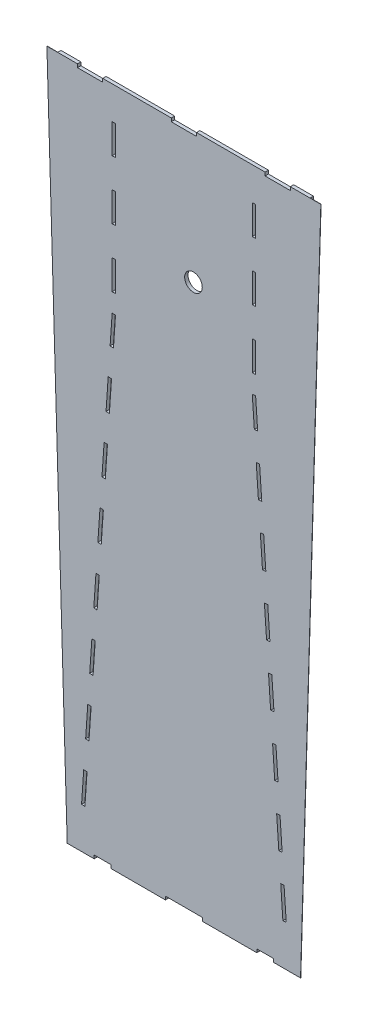
from build123d import *

# Parameters (mm, degrees)
SKETCH1_W           = 10.166490401
SKETCH1_H           = 88.9
BOSS_EXTRUDE1_DEPTH = 10.16
CUT_LOFT1_DEPTH     = 9.5
SKETCH6_R           = 26.581471798
CUT_EXTRUDE2_DEPTH  = 12


# Read off the part's stored shape, not the designer's step: Cut-Loft1
with BuildPart() as part:
    # Sketch1 → Boss-Extrude1 (new body)
    with BuildSketch(Plane.XY):
        Polygon((-245, 2053.071580455), (-245, 2042.911580455), (-321.2, 2042.911580455), (-321.2, 2053.071580455), (-413.472915973, 2053.071580455), (-352.180527886, 0), (-270.8, 0), (-270.8, 10.16), (-220, 10.16), (-220, 0), (-55.8292, 0), (-55.8292, 10.16), (55.8292, 10.16), (55.8292, 0), (220, 0), (220, 10.16), (270.8, 10.16), (270.8, 0), (352.180527886, 0), (413.472915973, 2053.071580455), (321.2, 2053.071580455), (321.2, 2042.911580455), (245, 2042.911580455), (245, 2053.071580455), (38.1, 2053.071580455), (38.1, 2042.911580455), (-38.1, 2042.911580455), (-38.1, 2053.071580455), align=None)
        with Locations((-211.45202358, 1909.561580455)):
            Rectangle(SKETCH1_W, SKETCH1_H, mode=Mode.SUBTRACT)
        with Locations((-211.45202358, 1731.761580455)):
            Rectangle(SKETCH1_W, SKETCH1_H, mode=Mode.SUBTRACT)
        Polygon((-298.801924037, 122.832814726), (-292.291252627, 216.569681682), (-302.408932711, 217.272424291), (-308.919604121, 123.535557335), align=None, mode=Mode.SUBTRACT)
        Polygon((-286.484012658, 300.178951146), (-279.971498388, 393.942350533), (-290.089178472, 394.645093142), (-296.601692742, 300.881693756), align=None, mode=Mode.SUBTRACT)
        Polygon((-274.16610128, 477.525087567), (-267.651744149, 571.315019385), (-277.769424233, 572.017761994), (-284.283781364, 478.227830176), align=None, mode=Mode.SUBTRACT)
        Polygon((-261.848189901, 654.871223988), (-255.33198991, 748.687688236), (-265.449669994, 749.390430845), (-271.965869985, 655.573966597), align=None, mode=Mode.SUBTRACT)
        Polygon((-249.530278522, 832.217360408), (-243.012235672, 926.060357088), (-253.129915756, 926.763099697), (-259.647958606, 832.920103017), align=None, mode=Mode.SUBTRACT)
        Polygon((-237.212367144, 1009.563496829), (-230.692481433, 1103.433025939), (-240.810161517, 1104.135768548), (-247.330047228, 1010.266239438), align=None, mode=Mode.SUBTRACT)
        Polygon((-224.894455765, 1186.909633249), (-218.372727194, 1280.805694791), (-228.490407278, 1281.5084374), (-235.012135849, 1187.612375858), align=None, mode=Mode.SUBTRACT)
        Polygon((-206.36877838, 1453.631580489), (-216.535268781, 1453.631580489), (-222.69422447, 1364.958512279), (-212.576544386, 1364.25576967), align=None, mode=Mode.SUBTRACT)
        Polygon((216.535268781, 1453.631580489), (206.36877838, 1453.631580489), (212.576544386, 1364.25576967), (222.69422447, 1364.958512279), align=None, mode=Mode.SUBTRACT)
        Polygon((218.372727194, 1280.805694791), (224.894455765, 1186.909633249), (235.012135849, 1187.612375858), (228.490407278, 1281.5084374), align=None, mode=Mode.SUBTRACT)
        Polygon((230.692481433, 1103.433025939), (237.212367144, 1009.563496829), (247.330047228, 1010.266239438), (240.810161517, 1104.135768548), align=None, mode=Mode.SUBTRACT)
        Polygon((243.012235672, 926.060357088), (249.530278522, 832.217360408), (259.647958606, 832.920103017), (253.129915756, 926.763099697), align=None, mode=Mode.SUBTRACT)
        Polygon((255.33198991, 748.687688236), (261.848189901, 654.871223988), (271.965869985, 655.573966597), (265.449669994, 749.390430845), align=None, mode=Mode.SUBTRACT)
        Polygon((267.651744149, 571.315019385), (274.16610128, 477.525087567), (284.283781364, 478.227830176), (277.769424233, 572.017761994), align=None, mode=Mode.SUBTRACT)
        Polygon((279.971498388, 393.942350533), (286.484012658, 300.178951146), (296.601692742, 300.881693756), (290.089178472, 394.645093142), align=None, mode=Mode.SUBTRACT)
        Polygon((292.291252627, 216.569681682), (298.801924037, 122.832814726), (308.919604121, 123.535557335), (302.408932711, 217.272424291), align=None, mode=Mode.SUBTRACT)
        with Locations((211.45202358, 1731.761580455)):
            Rectangle(SKETCH1_W, SKETCH1_H, mode=Mode.SUBTRACT)
        with Locations((-211.45202358, 1553.961580455)):
            Rectangle(SKETCH1_W, SKETCH1_H, mode=Mode.SUBTRACT)
        with Locations((211.45202358, 1553.961580455)):
            Rectangle(SKETCH1_W, SKETCH1_H, mode=Mode.SUBTRACT)
        with Locations((211.45202358, 1909.561580455)):
            Rectangle(SKETCH1_W, SKETCH1_H, mode=Mode.SUBTRACT)
    extrude(amount=BOSS_EXTRUDE1_DEPTH)

    # Cut-Loft1 outline → Cut-Loft1 (cut)
    with BuildSketch(Plane.XY):
        Polygon((413.472915973, 2053.071580455), (380.911770747, 2053.071580455), (319.430777619, 0), (352.180527886, 0), align=None)
    cut_loft1 = extrude(amount=CUT_LOFT1_DEPTH, mode=Mode.SUBTRACT)

    # Mirror1: Cut-Loft1 across plane
    add(cut_loft1.mirror(Plane(origin=(0, 0, 0), x_dir=(0, 0, 1), z_dir=(1, 0, 0))), mode=Mode.SUBTRACT)

    # Sketch6 → Cut-Extrude2 (cut)
    with BuildSketch(Plane.XY.offset(10.16)):
        with Locations((28.844157405, 1657.225539641)):
            Circle(SKETCH6_R)
    extrude(amount=-CUT_EXTRUDE2_DEPTH, mode=Mode.SUBTRACT)


solid = part.part
